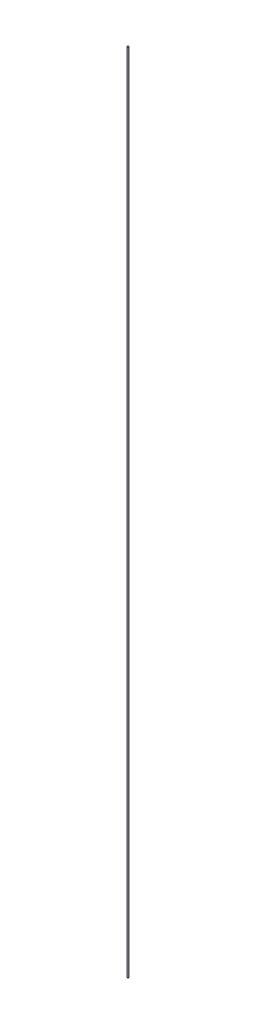
from build123d import *

# Parameters (mm, degrees)
SKETCH2_R           = 1.27
BOSS_EXTRUDE3_DEPTH = 1282.7


with BuildPart() as part:
    # Sketch2 → Boss-Extrude3 (new body)
    with BuildSketch(Plane(origin=(0, 0, 0), x_dir=(1, 0, 0), z_dir=(0, 1, 0))):
        Circle(SKETCH2_R)
    extrude(amount=BOSS_EXTRUDE3_DEPTH)


solid = part.part
